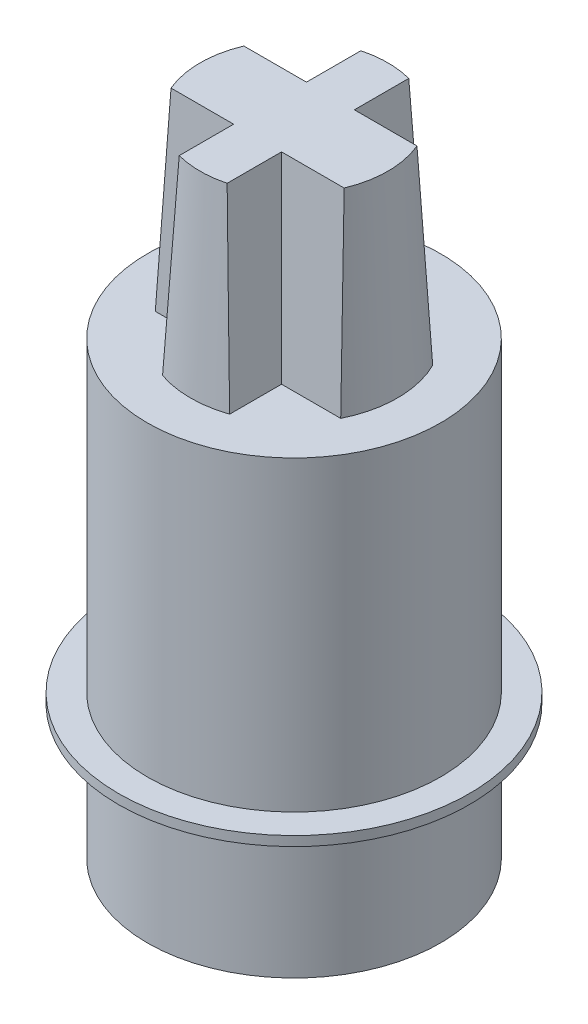
from build123d import *

# Parameters (mm, degrees)
SKETCH_594_R           = 7.65
CUT_EXTRUDE_2199_DEPTH = 10
CHAMFER_START          = -4.9
CHAMFER_1_2_DEPTH      = 3.6500001
CHAMFER_START_2        = 1.2499999
CHAMFER_1_3_DEPTH      = 3.6500001
CHAMFER_START_3        = -5.4
CHAMFER_1_4_DEPTH      = 3
CHAMFER_START_4        = 2.4
CHAMFER_1_5_DEPTH      = 3
CHAMFER_START_5        = -2.4
CHAMFER_1_6_DEPTH      = 4.8


with BuildPart() as part:
    # Sketch 286 → Revolve 549 (revolve)
    with BuildSketch(Plane.XY, mode=Mode.PRIVATE) as revolve_549_sk:
        Polygon((0, 0), (7.65, 0), (7.65, 7), (9.15, 7), (9.15, 7.5), (7.65, 7.5), (7.65, 33.5), (0, 33.5), align=None)
    revolve(revolve_549_sk.sketch.rotate(Axis((0, 16.255686087, 0), (0, -1, 0)), 90), axis=Axis((0, 16.255686087, 0), (0, -1, 0)))

    # Sketch 594 → Cut-Extrude 2199 (cut)
    with BuildSketch(Plane(origin=(0, 33.5, 0), x_dir=(1, 0, 0), z_dir=(0, 1, 0))):
        with Locations(Location((0, 0, 0), (0, 0, 270))):
            Circle(SKETCH_594_R)
        with BuildLine():
            Line((-1.75, 2.4), (-1.75, 5.108571229))
            ThreePointArc((-1.75, 5.108571229), (0, 5.4), (1.75, 5.108571229))
            Line((1.75, 5.108571229), (1.75, 2.4))
            Line((1.75, 2.4), (4.837354649, 2.4))
            ThreePointArc((4.837354649, 2.4), (5.4, 0), (4.837354649, -2.4))
            Line((4.837354649, -2.4), (1.75, -2.4))
            Line((1.75, -2.4), (1.75, -5.108571229))
            ThreePointArc((1.75, -5.108571229), (0, -5.4), (-1.75, -5.108571229))
            Line((-1.75, -5.108571229), (-1.75, -2.4))
            Line((-1.75, -2.4), (-4.837354649, -2.4))
            ThreePointArc((-4.837354649, -2.4), (-5.4, 0), (-4.837354649, 2.4))
            Line((-4.837354649, 2.4), (-1.75, 2.4))
        make_face(mode=Mode.SUBTRACT)
    extrude(amount=-CUT_EXTRUDE_2199_DEPTH, mode=Mode.SUBTRACT)

    # Фаска1: read off the stored shape, not the designer's step
    # Фаска1 outline → Фаска1 (revolve, cut)
    with BuildSketch(Plane.XY):
        Polygon((5.4, 33.5), (4.9, 33.5), (5.4, 23.5), align=None)
    revolve(axis=Axis((0, 0, 0), (0, 1, 0)), mode=Mode.SUBTRACT)

    # Chamfer 1 2 outline → Chamfer 1 2 (cut)
    with BuildSketch(Plane.YZ.offset(CHAMFER_START)):
        Polygon((23.5, 2.4), (33.5, 1.9), (33.5, 2.4), align=None)
        Polygon((33.5, -2.4), (33.5, -1.9), (23.5, -2.4), align=None)
    extrude(amount=CHAMFER_1_2_DEPTH, mode=Mode.SUBTRACT)

    # Chamfer 1 3 outline → Chamfer 1 3 (cut)
    with BuildSketch(Plane.YZ.offset(CHAMFER_START_2)):
        Polygon((23.5, 2.4), (33.5, 1.9), (33.5, 2.4), align=None)
        Polygon((33.5, -2.4), (33.5, -1.9), (23.5, -2.4), align=None)
    extrude(amount=CHAMFER_1_3_DEPTH, mode=Mode.SUBTRACT)

    # Chamfer 1 4 outline → Chamfer 1 4 (cut)
    with BuildSketch(Plane.XY.offset(CHAMFER_START_3)):
        Polygon((1.75, 33.5), (1.249999967, 33.5), (1.75, 23.5), align=None)
        Polygon((-1.75, 23.5), (-1.25, 33.5), (-1.75, 33.5), align=None)
    extrude(amount=CHAMFER_1_4_DEPTH, mode=Mode.SUBTRACT)

    # Chamfer 1 5 outline → Chamfer 1 5 (cut)
    with BuildSketch(Plane.XY.offset(CHAMFER_START_4)):
        Polygon((1.75, 33.5), (1.249999967, 33.5), (1.75, 23.5), align=None)
        Polygon((-1.75, 23.5), (-1.25, 33.5), (-1.75, 33.5), align=None)
    extrude(amount=CHAMFER_1_5_DEPTH, mode=Mode.SUBTRACT)

    # Chamfer 1 6 outline → Chamfer 1 6 (add)
    with BuildSketch(Plane.XY.offset(CHAMFER_START_5)):
        Polygon((1.75, 23.5), (1.25, 33.5), (1.2499999, 23.5), align=None)
        Polygon((-1.2499999, 23.5), (-1.2499999, 33.5), (-1.75, 23.5), align=None)
    extrude(amount=CHAMFER_1_6_DEPTH)


solid = part.part
